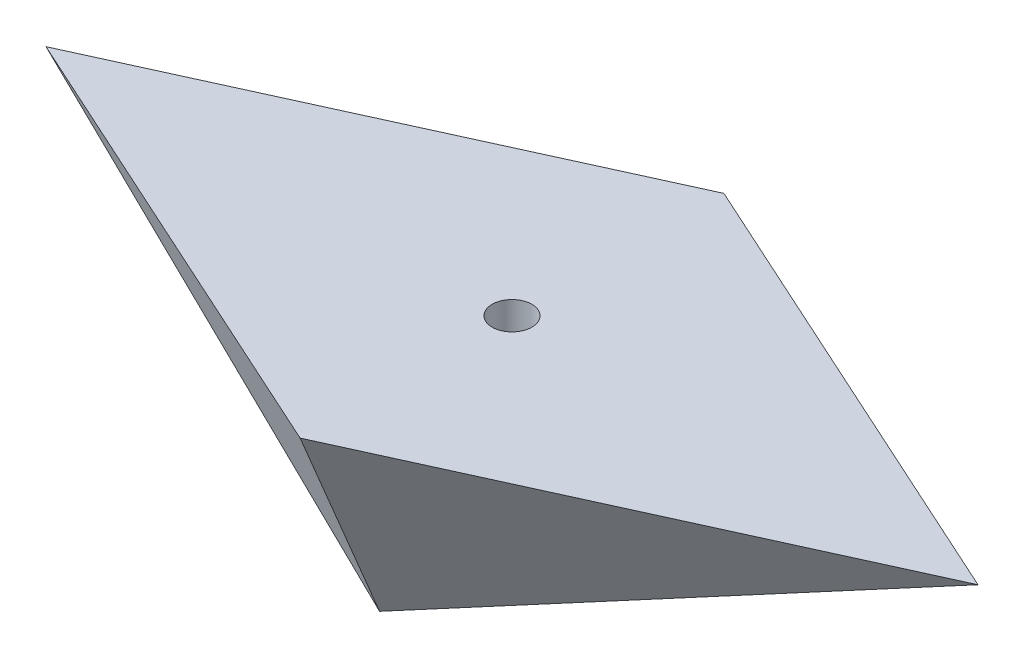
from build123d import *

# Parameters (mm, degrees)
BOSS_EXTRUDE1_DEPTH = 50.8
CUT_EXTRUDE1_REACH  = 267.827
SKETCH3_W           = 270.689015678
SKETCH3_H           = 127.641974873
SKETCH4_W           = 182.593572116
SKETCH4_H           = 90.656556142
CUT_EXTRUDE2_DEPTH  = 276.287495976
SKETCH5_R           = 4.7625
CUT_EXTRUDE3_DEPTH  = 234.611541089


# Read off the part's stored shape, not the designer's step: Cavity1
with BuildPart() as part:
    # Sketch1 → Boss-Extrude1 (new body)
    with BuildSketch(Plane.XY):
        Polygon((0, 162.912922238), (223.435555158, 162.912922238), (111.717777579, 117.412759364), align=None)
    boss_extrude1 = extrude(amount=BOSS_EXTRUDE1_DEPTH)

    # Sketch3 → Cut-Extrude1 (cut, up to next)
    with BuildSketch(Plane(origin=(22.441501566, 20.662959115, -49.352651191), x_dir=(0.9221668342969159, -0.1493780822790374, 0.35678357341312894), z_dir=(-0.38679235995919625, -0.3561381441534573, 0.8506217094314763)), mode=Mode.PRIVATE) as cut_extrude1_sk1:
        with Locations((94.443721281, 144.982742911)):
            Rectangle(SKETCH3_W, SKETCH3_H)
    cut_extrude1_tool1 = extrude(cut_extrude1_sk1.sketch, amount=CUT_EXTRUDE1_REACH, mode=Mode.PRIVATE) & part.part
    cut_extrude1 = cut_extrude1_tool1.solids().sort_by_distance((109.534369, 140.289581, 40.33523))[0]
    add(cut_extrude1, mode=Mode.SUBTRACT)

    # Sketch4 → Cut-Extrude2 (cut, through all)
    with BuildSketch(Plane(origin=(10.986318642, -10.115626722, 24.160769733), x_dir=(0.9221668342969159, 0.14937808227903746, -0.35678357341312883), z_dir=(0.3867923599591962, -0.3561381441534575, 0.8506217094314763))):
        with Locations((161.909836557, 133.814028117)):
            Rectangle(SKETCH4_W, SKETCH4_H)
    cut_extrude2 = extrude(amount=CUT_EXTRUDE2_DEPTH, mode=Mode.SUBTRACT)

    # Mirror1: Boss-Extrude1, Cut-Extrude1, Cut-Extrude2 across plane
    add(boss_extrude1.mirror(Plane.XY))
    add(cut_extrude1.mirror(Plane.XY), mode=Mode.SUBTRACT)
    add(cut_extrude2.mirror(Plane.XY), mode=Mode.SUBTRACT)

    # Sketch5 → Cut-Extrude3 (cut, through all)
    with BuildSketch(Plane(origin=(0, 162.912922238, 0), x_dir=(1, 0, 0), z_dir=(0, 1, 0))):
        with Locations(Location((111.717777579, 0, 0), (0, 0, 270))):
            Circle(SKETCH5_R)
    extrude(amount=-CUT_EXTRUDE3_DEPTH, mode=Mode.SUBTRACT)

    # Cavity1 outline → Cavity1 (revolve, cut)
    with BuildSketch(Plane(origin=(111.717777579, 0, 0), x_dir=(1, 0, 0), z_dir=(0, 0, 1))):
        Polygon((31.902660281, 131.804308366), (4.7625, 131.804308366), (4.7625, 117.412759364), (29.360304621, 117.412759364), align=None)
    revolve(axis=Axis((111.717777579, 0, 0), (0, 1, 0)), mode=Mode.SUBTRACT)


solid = part.part
